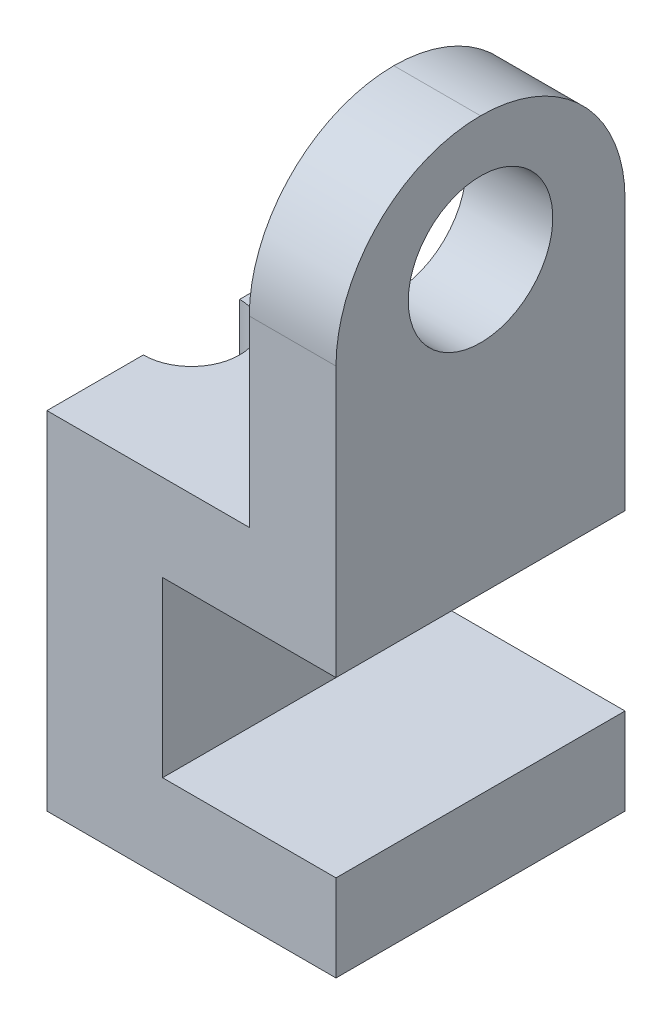
from build123d import *

# Parameters (mm, degrees)
IZIM1_W                     = 30
IZIM1_H                     = 30
Y_KSEKLIK_EKSTR_ZYON1_DEPTH = 36
IZIM3_W                     = 18
IZIM3_H                     = 18
KES_EKSTR_ZYON2_DEPTH       = 55.968631837
IZIM5_R                     = 5
KES_EKSTR_ZYON3_DEPTH       = 55.968631837
IZIM6_W                     = 9
IZIM6_H                     = 30
Y_KSEKLIK_EKSTR_ZYON2_DEPTH = 34
RADYUS1_R                   = 15
IZIM7_R                     = 7.5
KES_EKSTR_ZYON4_DEPTH       = 80


with BuildPart() as part:
    # Çizim1 → Yükseklik-Ekstrüzyon1 (new body)
    with BuildSketch(Plane(origin=(0, 0, 0), x_dir=(1, 0, 0), z_dir=(0, 1, 0))):
        with Locations((13.732394366, 15)):
            Rectangle(IZIM1_W, IZIM1_H)
    extrude(amount=Y_KSEKLIK_EKSTR_ZYON1_DEPTH)

    # Çizim3 → Kes-Ekstrüzyon2 (cut, through all)
    with BuildSketch(Plane.XY):
        with Locations((19.732394366, 18)):
            Rectangle(IZIM3_W, IZIM3_H)
    extrude(amount=-KES_EKSTR_ZYON2_DEPTH, mode=Mode.SUBTRACT)

    # Çizim5 → Kes-Ekstrüzyon3 (cut, through all)
    with BuildSketch(Plane(origin=(0, 36, 0), x_dir=(1, 0, 0), z_dir=(0, 1, 0))):
        with Locations((-1.267605634, 15)):
            Circle(IZIM5_R)
    extrude(amount=-KES_EKSTR_ZYON3_DEPTH, mode=Mode.SUBTRACT)

    # Çizim6 → Yükseklik-Ekstrüzyon2 (add)
    with BuildSketch(Plane(origin=(0, 36, 0), x_dir=(1, 0, 0), z_dir=(0, 1, 0))):
        with Locations((24.232394366, 15)):
            Rectangle(IZIM6_W, IZIM6_H)
    extrude(amount=Y_KSEKLIK_EKSTR_ZYON2_DEPTH)

    # Radyus1
    radyus1_edges = [part.edges().sort_by_distance(p)[0] for p in [
        (24.232394366, 70, 0),
        (24.232394366, 70, -30),
    ]]
    fillet(radyus1_edges, radius=RADYUS1_R - 0.0001)  # a hair under: the kernel refuses the full size

    # Çizim7 → Kes-Ekstrüzyon4 (cut, through all)
    with BuildSketch(Plane.ZY.offset(-19.732394366)):
        with Locations((-15, 57.087838251)):
            Circle(IZIM7_R)
    extrude(amount=-KES_EKSTR_ZYON4_DEPTH, mode=Mode.SUBTRACT)


solid = part.part
